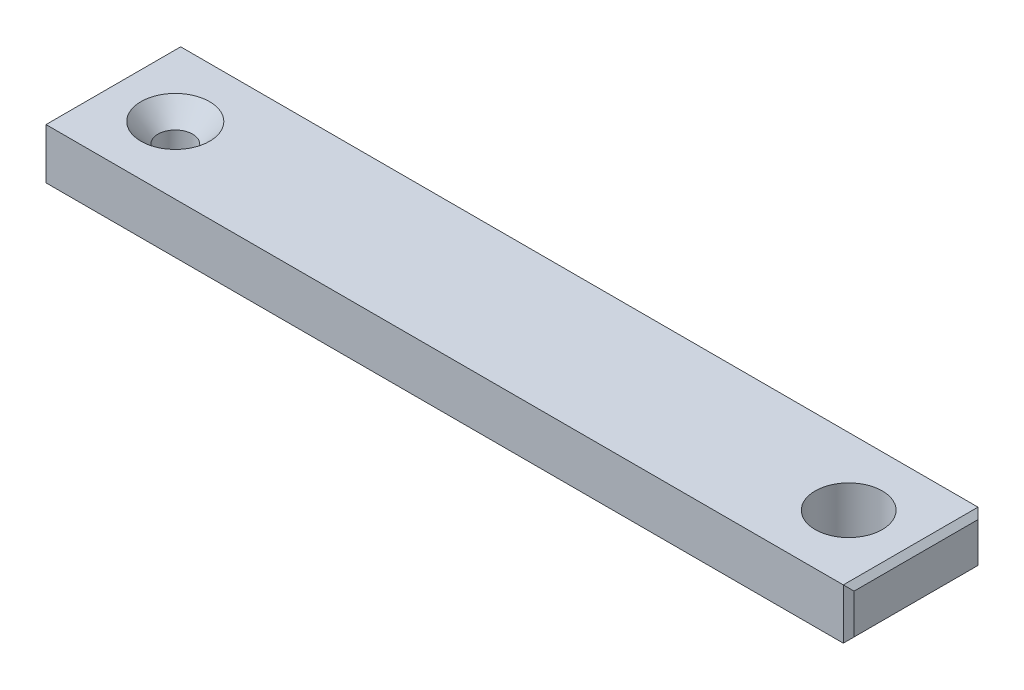
from build123d import *

# Parameters (mm, degrees)
SKETCH1_W                                         = 76.2
SKETCH1_H                                         = 12.7
BOSS_EXTRUDE2_DEPTH                               = 4.7625
CSK_FOR_4_FLAT_HEAD_SOCKET_CAP_SCREW1_D           = 3.2639
CSK_FOR_4_FLAT_HEAD_SOCKET_CAP_SCREW1_CSINK_D     = 6.477
CSK_FOR_4_FLAT_HEAD_SOCKET_CAP_SCREW1_CSINK_ANGLE = 82
SKETCH2_R                                         = 3.1623
CUT_EXTRUDE1_DEPTH                                = 71.299547696
CHAMFER1_SIZE                                     = 0.508


with BuildPart() as part:
    # Sketch1 → Boss-Extrude2 (new body)
    with BuildSketch(Plane(origin=(0, 0, 0), x_dir=(1, 0, 0), z_dir=(0, 1, 0))):
        with BuildLine():
            Line((-63.5, 6.35), (0, 6.35))
            ThreePointArc((0, 6.35), (6.35, 0), (0, -6.35))
            Line((0, -6.35), (-63.5, -6.35))
            ThreePointArc((-63.5, -6.35), (-69.85, 0), (-63.5, 6.35))
        make_face()
        with Locations((-31.75, 0)):
            Rectangle(SKETCH1_W, SKETCH1_H)
    extrude(amount=BOSS_EXTRUDE2_DEPTH)

    # CSK for #4 Flat Head Socket Cap Screw1 (through all)
    with Locations(Plane(origin=(0, 4.7625, 0), x_dir=(1, 0, 0), z_dir=(0, 1, 0))):
        with Locations((-63.5, 0)):
            CounterSinkHole(CSK_FOR_4_FLAT_HEAD_SOCKET_CAP_SCREW1_D / 2, CSK_FOR_4_FLAT_HEAD_SOCKET_CAP_SCREW1_CSINK_D / 2, counter_sink_angle=CSK_FOR_4_FLAT_HEAD_SOCKET_CAP_SCREW1_CSINK_ANGLE)

    # Sketch2 → Cut-Extrude1 (cut, through all)
    with BuildSketch(Plane(origin=(0, 4.7625, 0), x_dir=(1, 0, 0), z_dir=(0, 1, 0))):
        Circle(SKETCH2_R)
    extrude(amount=-CUT_EXTRUDE1_DEPTH, mode=Mode.SUBTRACT)

    # Chamfer1
    chamfer1_edges = [part.edges().sort_by_distance(p)[0] for p in [
        (-69.85, 2.38125, -6.35),
        (-69.85, 4.7625, 0),
        (-69.85, 2.38125, 6.35),
        (-69.85, 0, 0),
        (6.35, 2.38125, 6.35),
        (6.35, 4.7625, 0),
        (6.35, 2.38125, -6.35),
        (6.35, 0, 0),
    ]]
    chamfer(chamfer1_edges, length=CHAMFER1_SIZE)


solid = part.part
